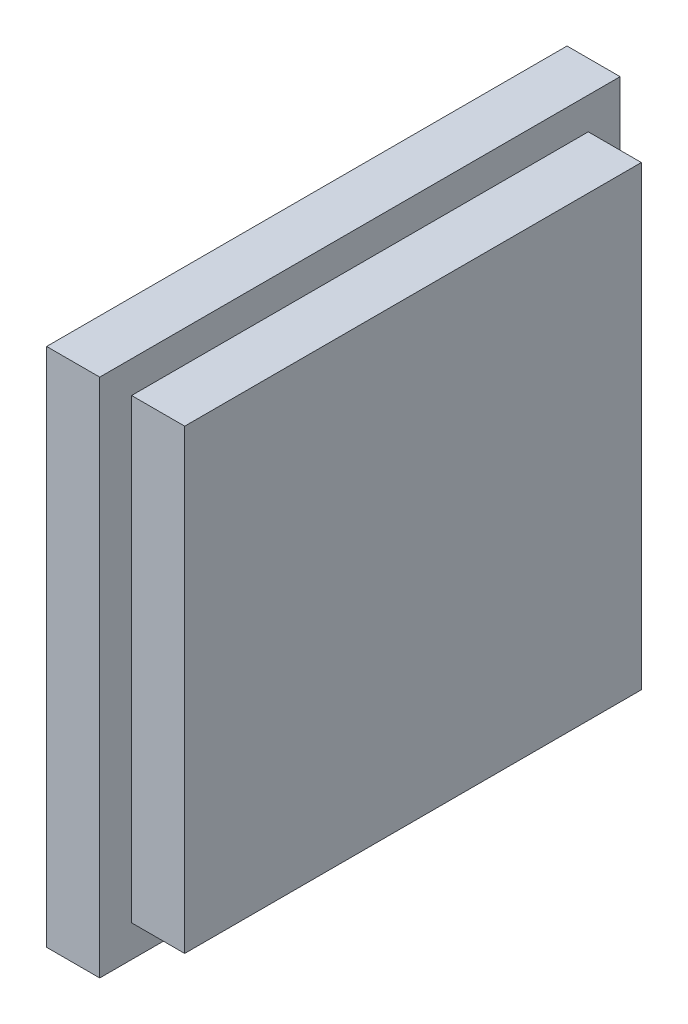
from build123d import *

# Parameters (mm, degrees)
SKETCH1_W           = 49
SKETCH1_H           = 49
BOSS_EXTRUDE1_DEPTH = 5
SKETCH3_W           = 43
SKETCH3_H           = 43
BOSS_EXTRUDE3_DEPTH = 5


with BuildPart() as part:
    # Sketch1 → Boss-Extrude1 (new body)
    with BuildSketch(Plane(origin=(0, 0, 0), x_dir=(0, 0, -1), z_dir=(1, 0, 0))):
        Rectangle(SKETCH1_W, SKETCH1_H)
    extrude(amount=BOSS_EXTRUDE1_DEPTH)

    # Sketch3 → Boss-Extrude3 (add)
    with BuildSketch(Plane(origin=(5, 0, 0), x_dir=(0, 0, -1), z_dir=(1, 0, 0))):
        Rectangle(SKETCH3_W, SKETCH3_H)
    extrude(amount=BOSS_EXTRUDE3_DEPTH)


solid = part.part
